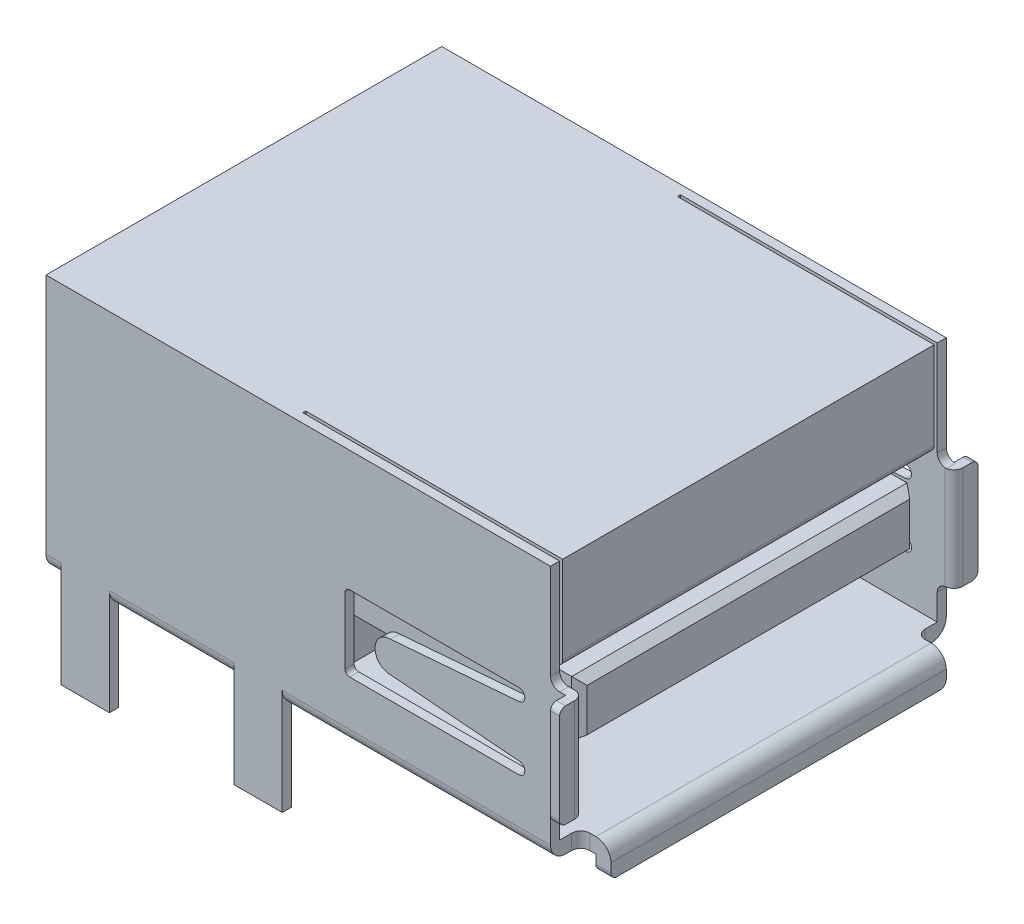
from build123d import *
from OCP.BRepFilletAPI import BRepFilletAPI_MakeChamfer

# Parameters (mm, degrees)
BOSS_EXTRU_1_DEPTH      = 13.1
ESQUISSE2_W             = 12.5
ESQUISSE2_H             = 3
ENL_V_MAT_EXTRU_1_DEPTH = 7.4
ESQUISSE3_W             = 11.1
ESQUISSE3_H             = 1.84
ENL_V_MAT_EXTRU_2_DEPTH = 8.5
ESQUISSE4_W             = 0.3
ESQUISSE4_H             = 3.4
BOSS_EXTRU_2_DEPTH      = 0.5
BOSS_EXTRU_3_DEPTH      = 3.4
BOSS_EXTRU_4_DEPTH      = 3.4
CHANFREIN1_SIZE         = 0.3
CHANFREIN1_SIZE2        = 0.210062261
CHANFREIN2_SIZE         = 0.3
CHANFREIN2_SIZE2        = 0.210062261
CHANFREIN3_SIZE         = 0.3
CHANFREIN3_SIZE2        = 0.210062261
CONG_1_R                = 0.2
CONG_2_R                = 0.2
ESQUISSE10_W            = 0.5
ESQUISSE10_H            = 0.5
ENL_V_MAT_EXTRU_3_DEPTH = 1
ESQUISSE11_W            = 0.5
ESQUISSE11_H            = 0.5
ENL_V_MAT_EXTRU_4_DEPTH = 1
BOSS_EXTRU_5_DEPTH      = 11.1
CONG_3_R                = 0.5
CONG_4_R                = 0.5
ENL_V_MAT_EXTRU_5_DEPTH = 0.3
ENL_V_START             = -0.3
ENL_V_MAT_EXTRU_6_DEPTH = 0.3
CONG_5_R                = 0.2
CONG_6_R                = 0.3


with BuildPart() as part:
    # Esquisse1 → Boss.-Extru.1 (new body)
    with BuildSketch(Plane.XY):
        Polygon((0, 0), (0, 8.5), (16.7, 8.5), (16.7, 0.5), (17.2, 0.5), (17.2, 0), (7.82, 0), (7.82, -3), (6.22, -3), (6.22, 0), (2.1, 0), (2.1, -3), (0.5, -3), (0.5, 0), align=None)
    extrude(amount=BOSS_EXTRU_1_DEPTH)

    # Esquisse2 → Enlèv. mat.-Extru.1 (cut)
    with BuildSketch(Plane.ZY.offset(-0.5)):
        with Locations((6.55, -1.5)):
            Rectangle(ESQUISSE2_W, ESQUISSE2_H)
    extrude(amount=-ENL_V_MAT_EXTRU_1_DEPTH, mode=Mode.SUBTRACT)

    # Esquisse3 → Enlèv. mat.-Extru.2 (cut)
    with BuildSketch(Plane(origin=(16.7, 0, 0), x_dir=(0, 0, -1), z_dir=(1, 0, 0))):
        Polygon((-12.8, 8.5), (-12.8, 0.5), (-0.3, 0.5), (-0.3, 8.5), (-0.4, 8.5), (-0.4, 5.4), (-12.7, 5.4), (-12.7, 8.5), align=None)
        with Locations((-6.55, 3.77)):
            Rectangle(ESQUISSE3_W, ESQUISSE3_H, mode=Mode.SUBTRACT)
    extrude(amount=-ENL_V_MAT_EXTRU_2_DEPTH, mode=Mode.SUBTRACT)

    # Esquisse4 → Boss.-Extru.2 (add)
    with BuildSketch(Plane(origin=(16.7, 0, 0), x_dir=(0, 0, -1), z_dir=(1, 0, 0))):
        with Locations((-12.95, 3.35)):
            Rectangle(ESQUISSE4_W, ESQUISSE4_H)
    extrude(amount=BOSS_EXTRU_2_DEPTH)

    # Esquisse8 → Boss.-Extru.3 (add)
    with BuildSketch(Plane(origin=(17.2, 1.65, 13.1), x_dir=(1, 0, 0), z_dir=(0, -1, 0))):
        with BuildLine():
            Line((0, 0), (0, 0.5))
            Line((0, 0.5), (0.3, 0.5))
            Line((0.3, 0.5), (0.3, 0))
            ThreePointArc((0.3, 0), (0.212132034, -0.212132034), (0, -0.3))
            Line((0, -0.3), (0, 0))
        make_face()
    extrude(amount=-BOSS_EXTRU_3_DEPTH)

    # Esquisse9 → Boss.-Extru.4 (add)
    with BuildSketch(Plane(origin=(17.2, 1.65, 13.1), x_dir=(1, 0, 0), z_dir=(0, -1, 0))):
        with BuildLine():
            Line((-0.5, -13.1), (-0.25, -13.1))
            Line((-0.25, -13.1), (-0.25, -13.6))
            Line((-0.25, -13.6), (0.05, -13.6))
            Line((0.05, -13.6), (0.05, -13.1))
            ThreePointArc((0.05, -13.1), (-0.037867966, -12.887867966), (-0.25, -12.8))
            Line((-0.25, -12.8), (-0.5, -12.8))
            Line((-0.5, -12.8), (-0.5, -13.1))
        make_face()
    extrude(amount=-BOSS_EXTRU_4_DEPTH)

    # Chanfrein1
    chanfrein1_edges = [part.edges().sort_by_distance(p)[0] for p in [
        (16.7, 4.69, 6.55),
    ]]
    chanfrein1_side = [part.faces().sort_by_distance(p)[0] for p in [
        (12.45, 4.69, 6.55),
    ]]
    chamfer(chanfrein1_edges, length=CHANFREIN1_SIZE, length2=CHANFREIN1_SIZE2, reference=chanfrein1_side[0])

    # Chanfrein2
    chanfrein2_edges = [part.edges().sort_by_distance(p)[0] for p in [
        (16.7, 3.664968869, 1),
    ]]
    chanfrein2_side = [part.faces().sort_by_distance(p)[0] for p in [
        (12.441622268, 3.768284121, 1),
    ]]
    chamfer(chanfrein2_edges, length=CHANFREIN2_SIZE, length2=CHANFREIN2_SIZE2, reference=chanfrein2_side[0])

    # Chanfrein3: one chamfer whose edges measure the first distance from different faces: ONE call of the kernel's chamfer builder (chamfer() names one face for all edges)
    chanfrein3_edges_1 = [part.edges().sort_by_distance(p)[0] for p in [
        (16.7, 3.664968869, 12.1),
    ]]
    chanfrein3_side_1 = [part.faces().sort_by_distance(p)[0] for p in [
        (12.441622268, 3.768284121, 12.1),
    ]]
    chanfrein3_edges_2 = [part.edges().sort_by_distance(p)[0] for p in [
        (16.7, 2.85, 6.655031131),
    ]]
    chanfrein3_side_2 = [part.faces().sort_by_distance(p)[0] for p in [
        (12.448613594, 2.85, 6.551830718),
    ]]
    chanfrein3 = BRepFilletAPI_MakeChamfer(part.part.solid().wrapped)
    for e in chanfrein3_edges_1:
        chanfrein3.Add(CHANFREIN3_SIZE, CHANFREIN3_SIZE2, e.wrapped, chanfrein3_side_1[0].wrapped)  # the first distance lies on this face
    for e in chanfrein3_edges_2:
        chanfrein3.Add(CHANFREIN3_SIZE, CHANFREIN3_SIZE2, e.wrapped, chanfrein3_side_2[0].wrapped)  # the first distance lies on this face
    add(Compound.cast(chanfrein3.Shape()), mode=Mode.REPLACE)

    # Congé1
    cong_1_edges = [part.edges().sort_by_distance(p)[0] for p in [
        (16.7, 5.4, 6.55),
    ]]
    fillet(cong_1_edges, radius=CONG_1_R)

    # Congé2
    cong_2_edges = [part.edges().sort_by_distance(p)[0] for p in [
        (17.35, 5.05, 13.6),
        (17.35, 1.65, 13.6),
        (17.1, 5.05, -0.5),
        (17.1, 1.65, -0.5),
    ]]
    fillet(cong_2_edges, radius=CONG_2_R)

    # Esquisse10 → Enlèv. mat.-Extru.3 (cut)
    with BuildSketch(Plane(origin=(0, 0, 0), x_dir=(-1, 0, 0), z_dir=(0, 0, -1))):
        with Locations((-16.95, 0.25)):
            Rectangle(ESQUISSE10_W, ESQUISSE10_H)
    extrude(amount=-ENL_V_MAT_EXTRU_3_DEPTH, mode=Mode.SUBTRACT)

    # Esquisse11 → Enlèv. mat.-Extru.4 (cut)
    with BuildSketch(Plane.XY.offset(13.1)):
        with Locations((16.95, 0.25)):
            Rectangle(ESQUISSE11_W, ESQUISSE11_H)
    extrude(amount=-ENL_V_MAT_EXTRU_4_DEPTH, mode=Mode.SUBTRACT)

    # Esquisse12 → Boss.-Extru.5 (add)
    with BuildSketch(Plane.XY.offset(12.1)):
        with BuildLine():
            Line((17.2, 0.5), (17.2, 0))
            Line((17.2, 0), (17.2, -0.5))
            Line((17.2, -0.5), (17.7, -0.5))
            Line((17.7, -0.5), (17.7, 0))
            ThreePointArc((17.7, 0), (17.553553391, 0.353553391), (17.2, 0.5))
        make_face()
    extrude(amount=-BOSS_EXTRU_5_DEPTH)

    # Congé3
    # the kernel refuses this fillet: 0.5 mm, written as the material it adds along each edge
    # the kernel refuses this fillet: 0.5 mm, written as the material it takes off along each edge
    with BuildSketch(Plane(origin=(7.47, 0, 13.1), x_dir=(0, 1, 0), z_dir=(-1, 0, 0))) as cong_3_2_piece_1_section:
        with BuildLine():
            CenterArc((CONG_3_R, CONG_3_R), CONG_3_R, 180, 90)
            Line((0, CONG_3_R), (0, 0))
            Line((0, 0), (CONG_3_R, 0))
        make_face()
    cong_3_2_piece_1 = extrude(amount=6.62, mode=Mode.PRIVATE)
    cong_3_2_piece_1 = split(cong_3_2_piece_1, bisect_by=Plane(origin=(6.845, 0.012427722, 12.8), z_dir=(0, 0, -1)), keep=Keep.TOP, mode=Mode.PRIVATE)
    add(cong_3_2_piece_1, mode=Mode.SUBTRACT)
    with BuildSketch(Plane(origin=(6.22, 0, 13.1), x_dir=(0, 1, 0), z_dir=(-1, 0, 0))) as cong_3_2_piece_2:
        with BuildLine():
            CenterArc((CONG_3_R, CONG_3_R), CONG_3_R, 180, 90)
            Line((0, CONG_3_R), (0, 0))
            Line((0, 0), (CONG_3_R, 0))
        make_face()
    extrude(amount=4.12, mode=Mode.SUBTRACT)
    with BuildSketch(Plane(origin=(17.95, 0, 13.1), x_dir=(0, 1, 0), z_dir=(-1, 0, 0))) as cong_3_2_piece_3:
        with BuildLine():
            CenterArc((CONG_3_R, CONG_3_R), CONG_3_R, 180, 90)
            Line((0, CONG_3_R), (0, 0))
            Line((0, 0), (CONG_3_R, 0))
        make_face()
    extrude(amount=10.13, mode=Mode.SUBTRACT)
    with BuildSketch(Plane(origin=(17.95, 0, 13.1), x_dir=(0, 1, 0), z_dir=(-1, 0, 0))) as cong_3_2_piece_4_section:
        with BuildLine():
            CenterArc((CONG_3_R, CONG_3_R), CONG_3_R, 180, 90)
            Line((0, CONG_3_R), (0, 0))
            Line((0, 0), (CONG_3_R, 0))
        make_face()
    cong_3_2_piece_4 = extrude(amount=11.38, mode=Mode.PRIVATE)
    cong_3_2_piece_4 = split(cong_3_2_piece_4, bisect_by=Plane(origin=(7.195, 0.012427722, 12.8), z_dir=(0, 0, -1)), keep=Keep.TOP, mode=Mode.PRIVATE)
    add(cong_3_2_piece_4, mode=Mode.SUBTRACT)
    with BuildSketch(Plane(origin=(1.75, 0, 13.1), x_dir=(0, 1, 0), z_dir=(-1, 0, 0))) as cong_3_2_piece_5_section:
        with BuildLine():
            CenterArc((CONG_3_R, CONG_3_R), CONG_3_R, 180, 90)
            Line((0, CONG_3_R), (0, 0))
            Line((0, 0), (CONG_3_R, 0))
        make_face()
    cong_3_2_piece_5 = extrude(amount=3, mode=Mode.PRIVATE)
    cong_3_2_piece_5 = split(cong_3_2_piece_5, bisect_by=Plane(origin=(1.125, 0.012427722, 12.8), z_dir=(0, 0, -1)), keep=Keep.TOP, mode=Mode.PRIVATE)
    add(cong_3_2_piece_5, mode=Mode.SUBTRACT)
    with BuildSketch(Plane(origin=(0.5, 0, 13.1), x_dir=(0, 1, 0), z_dir=(-1, 0, 0))) as cong_3_2_piece_6:
        with BuildLine():
            CenterArc((CONG_3_R, CONG_3_R), CONG_3_R, 180, 90)
            Line((0, CONG_3_R), (0, 0))
            Line((0, 0), (CONG_3_R, 0))
        make_face()
    extrude(amount=1.75, mode=Mode.SUBTRACT)

    # Congé4
    # the kernel refuses this fillet: 0.5 mm, written as the material it adds along each edge
    # the kernel refuses this fillet: 0.5 mm, written as the material it takes off along each edge
    with BuildSketch(Plane(origin=(17.95, 0, 0), x_dir=(0, 1, 0), z_dir=(-1, 0, 0))) as cong_4_2_piece_1:
        with BuildLine():
            CenterArc((CONG_4_R, -CONG_4_R), CONG_4_R, 90, 90)
            Line((0, -CONG_4_R), (0, 0))
            Line((0, 0), (CONG_4_R, 0))
        make_face()
    extrude(amount=10.13, mode=Mode.SUBTRACT)
    with BuildSketch(Plane(origin=(17.95, 0, 0), x_dir=(0, 1, 0), z_dir=(-1, 0, 0))) as cong_4_2_piece_2_section:
        with BuildLine():
            CenterArc((CONG_4_R, -CONG_4_R), CONG_4_R, 90, 90)
            Line((0, -CONG_4_R), (0, 0))
            Line((0, 0), (CONG_4_R, 0))
        make_face()
    cong_4_2_piece_2 = extrude(amount=11.38, mode=Mode.PRIVATE)
    cong_4_2_piece_2 = split(cong_4_2_piece_2, bisect_by=Plane(origin=(7.195, 0.012427722, 0.3), z_dir=(0, 0, 1)), keep=Keep.TOP, mode=Mode.PRIVATE)
    add(cong_4_2_piece_2, mode=Mode.SUBTRACT)
    with BuildSketch(Plane(origin=(7.47, 0, 0), x_dir=(0, 1, 0), z_dir=(-1, 0, 0))) as cong_4_2_piece_3_section:
        with BuildLine():
            CenterArc((CONG_4_R, -CONG_4_R), CONG_4_R, 90, 90)
            Line((0, -CONG_4_R), (0, 0))
            Line((0, 0), (CONG_4_R, 0))
        make_face()
    cong_4_2_piece_3 = extrude(amount=6.62, mode=Mode.PRIVATE)
    cong_4_2_piece_3 = split(cong_4_2_piece_3, bisect_by=Plane(origin=(6.845, 0.012427722, 0.3), z_dir=(0, 0, 1)), keep=Keep.TOP, mode=Mode.PRIVATE)
    add(cong_4_2_piece_3, mode=Mode.SUBTRACT)
    with BuildSketch(Plane(origin=(6.22, 0, 0), x_dir=(0, 1, 0), z_dir=(-1, 0, 0))) as cong_4_2_piece_4:
        with BuildLine():
            CenterArc((CONG_4_R, -CONG_4_R), CONG_4_R, 90, 90)
            Line((0, -CONG_4_R), (0, 0))
            Line((0, 0), (CONG_4_R, 0))
        make_face()
    extrude(amount=4.12, mode=Mode.SUBTRACT)
    with BuildSketch(Plane(origin=(1.75, 0, 0), x_dir=(0, 1, 0), z_dir=(-1, 0, 0))) as cong_4_2_piece_5_section:
        with BuildLine():
            CenterArc((CONG_4_R, -CONG_4_R), CONG_4_R, 90, 90)
            Line((0, -CONG_4_R), (0, 0))
            Line((0, 0), (CONG_4_R, 0))
        make_face()
    cong_4_2_piece_5 = extrude(amount=3, mode=Mode.PRIVATE)
    cong_4_2_piece_5 = split(cong_4_2_piece_5, bisect_by=Plane(origin=(1.125, 0.012427722, 0.3), z_dir=(0, 0, 1)), keep=Keep.TOP, mode=Mode.PRIVATE)
    add(cong_4_2_piece_5, mode=Mode.SUBTRACT)
    with BuildSketch(Plane(origin=(0.5, 0, 0), x_dir=(0, 1, 0), z_dir=(-1, 0, 0))) as cong_4_2_piece_6:
        with BuildLine():
            CenterArc((CONG_4_R, -CONG_4_R), CONG_4_R, 90, 90)
            Line((0, -CONG_4_R), (0, 0))
            Line((0, 0), (CONG_4_R, 0))
        make_face()
    extrude(amount=1.75, mode=Mode.SUBTRACT)

    # Esquisse13 → Enlèv. mat.-Extru.5 (cut)
    with BuildSketch(Plane.XY.offset(13.1)):
        with BuildLine():
            Line((9.9, 4.35), (9.9, 2.15))
            ThreePointArc((9.9, 2.15), (9.943933983, 2.043933983), (10.05, 2))
            Line((10.05, 2), (15.65, 2))
            ThreePointArc((15.65, 2), (15.85, 2.2), (15.65, 2.4))
            Line((15.65, 2.4), (11.4, 2.74))
            ThreePointArc((11.4, 2.74), (10.89, 3.25), (11.4, 3.76))
            Line((11.4, 3.76), (15.65, 4.1))
            ThreePointArc((15.65, 4.1), (15.85, 4.3), (15.65, 4.5))
            Line((15.65, 4.5), (10.05, 4.5))
            ThreePointArc((10.05, 4.5), (9.943933983, 4.456066017), (9.9, 4.35))
        make_face()
    extrude(amount=-ENL_V_MAT_EXTRU_5_DEPTH, mode=Mode.SUBTRACT)

    # Esquisse14 → Enlèv. mat.-Extru.6 (cut)
    with BuildSketch(Plane(origin=(0, 0, 0), x_dir=(-1, 0, 0), z_dir=(0, 0, -1)).offset(ENL_V_START)):
        with BuildLine():
            Line((-15.65, 4.5), (-10.05, 4.5))
            ThreePointArc((-10.05, 4.5), (-9.943933983, 4.456066017), (-9.9, 4.35))
            Line((-9.9, 4.35), (-9.9, 2.15))
            ThreePointArc((-9.9, 2.15), (-9.943933983, 2.043933983), (-10.05, 2))
            Line((-10.05, 2), (-15.65, 2))
            ThreePointArc((-15.65, 2), (-15.85, 2.2), (-15.65, 2.4))
            Line((-15.65, 2.4), (-11.4, 2.74))
            ThreePointArc((-11.4, 2.74), (-10.89, 3.25), (-11.4, 3.76))
            Line((-11.4, 3.76), (-15.65, 4.1))
            ThreePointArc((-15.65, 4.1), (-15.85, 4.3), (-15.65, 4.5))
        make_face()
    extrude(amount=ENL_V_MAT_EXTRU_6_DEPTH, mode=Mode.SUBTRACT)

    # Congé5
    cong_5_edges = [part.edges().sort_by_distance(p)[0] for p in [
        (17.45, -0.5, 1),
        (17.45, -0.5, 12.1),
    ]]
    fillet(cong_5_edges, radius=CONG_5_R)

    # Congé6
    # the kernel refuses this fillet: 0.3 mm, written as the material it adds along each edge
    with BuildSketch(Plane(origin=(16.7, 5.05, 12.8), x_dir=(0, 1, 0), z_dir=(0, 0, 1)), Plane(origin=(16.7, 1.65, 13.1), x_dir=(0, -1, 0), z_dir=(0, 0, -1))) as cong_6_piece_1:
        with BuildLine():
            CenterArc((CONG_6_R, -CONG_6_R), CONG_6_R, 90, 90)
            Line((0, -CONG_6_R), (0, 0))
            Line((0, 0), (CONG_6_R, 0))
        make_face()
    extrude(amount=0.3)
    with BuildSketch(Plane(origin=(16.7, 1.65, 0.3), x_dir=(0, -1, 0), z_dir=(0, 0, -1))) as cong_6_piece_2_section:
        with BuildLine():
            CenterArc((CONG_6_R, -CONG_6_R), CONG_6_R, 90, 90)
            Line((0, -CONG_6_R), (0, 0))
            Line((0, 0), (CONG_6_R, 0))
        make_face()
    cong_6_piece_2 = extrude(amount=0.3, mode=Mode.PRIVATE)
    cong_6_piece_2 = split(cong_6_piece_2, bisect_by=Plane(origin=(16.95, 1.588616671, 0.116964364), z_dir=(-1, 0, 0)), keep=Keep.TOP, mode=Mode.PRIVATE)
    add(cong_6_piece_2)
    with BuildSketch(Plane(origin=(16.7, 1.65, 1.05), x_dir=(0, -1, 0), z_dir=(0, 0, -1))) as cong_6_piece_3_section:
        with BuildLine():
            CenterArc((CONG_6_R, -CONG_6_R), CONG_6_R, 90, 90)
            Line((0, -CONG_6_R), (0, 0))
            Line((0, 0), (CONG_6_R, 0))
        make_face()
    cong_6_piece_3 = extrude(amount=1.05, mode=Mode.PRIVATE)
    cong_6_piece_3 = cong_6_piece_3 & Plane(origin=(16.95, 1.648741802, 0), x_dir=(1, 0, 0), z_dir=(0, -1, 0)) * Cylinder(0.3, 4, mode=Mode.PRIVATE)
    add(cong_6_piece_3)
    with BuildSketch(Plane(origin=(16.7, 5.05, 0.3), x_dir=(0, 1, 0), z_dir=(0, 0, -1))) as cong_6_piece_4_section:
        with BuildLine():
            CenterArc((CONG_6_R, CONG_6_R), CONG_6_R, 180, 90)
            Line((0, CONG_6_R), (0, 0))
            Line((0, 0), (CONG_6_R, 0))
        make_face()
    cong_6_piece_4 = extrude(amount=0.3, mode=Mode.PRIVATE)
    cong_6_piece_4 = split(cong_6_piece_4, bisect_by=Plane(origin=(16.95, 5.111383329, 0.116964364), z_dir=(-1, 0, 0)), keep=Keep.TOP, mode=Mode.PRIVATE)
    add(cong_6_piece_4)
    with BuildSketch(Plane(origin=(16.7, 5.05, 1.05), x_dir=(0, 1, 0), z_dir=(0, 0, -1))) as cong_6_piece_5_section:
        with BuildLine():
            CenterArc((CONG_6_R, CONG_6_R), CONG_6_R, 180, 90)
            Line((0, CONG_6_R), (0, 0))
            Line((0, 0), (CONG_6_R, 0))
        make_face()
    cong_6_piece_5 = extrude(amount=1.05, mode=Mode.PRIVATE)
    cong_6_piece_5 = cong_6_piece_5 & Plane(origin=(16.95, 5.051258198, 0), x_dir=(1, 0, 0), z_dir=(0, -1, 0)) * Cylinder(0.3, 4, mode=Mode.PRIVATE)
    add(cong_6_piece_5)
    with BuildSketch(Plane(origin=(16.7, 0, 1), x_dir=(1, 0, 0), z_dir=(0, 1, 0)), Plane(origin=(16.7, 0.5, 12.1), x_dir=(1, 0, 0), z_dir=(0, -1, 0))) as cong_6_piece_6:
        with BuildLine():
            CenterArc((CONG_6_R, CONG_6_R), CONG_6_R, 180, 90)
            Line((0, CONG_6_R), (0, 0))
            Line((0, 0), (CONG_6_R, 0))
        make_face()
    extrude(amount=0.5)


solid = part.part
